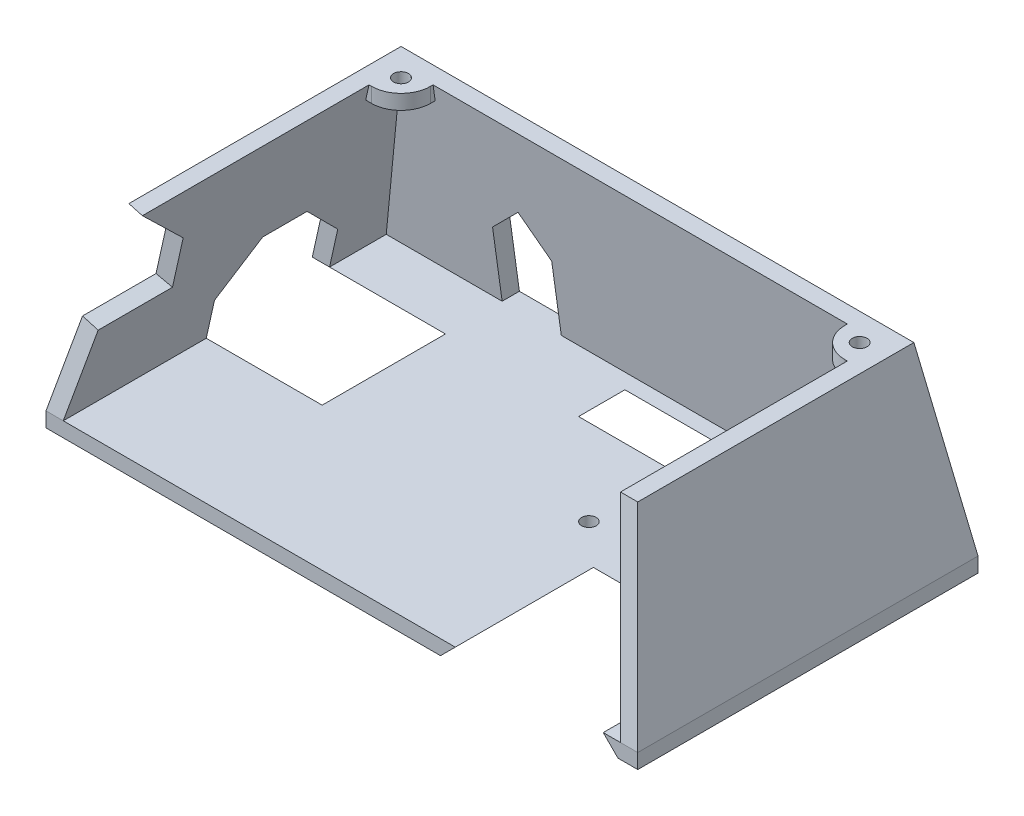
from build123d import *

# Parameters (mm, degrees)
SKETCH2_W           = 50
SKETCH2_H           = 9.4
BOSS_EXTRUDE1_DEPTH = 3
BOSS_EXTRUDE2_DEPTH = 3
CUT_EXTRUDE1_REACH  = 145.812
SKETCH6_R           = 1.5
SKETCH7_W           = 33
SKETCH7_H           = 25
CUT_EXTRUDE2_DEPTH  = 18.5
CHAMFER1_SIZE       = 3
CUT_EXTRUDE4_REACH  = 145.812
CHAMFER2_SIZE       = 3
CHAMFER3_SIZE       = 3
CUT_EXTRUDE5_REACH  = 145.812
SKETCH9_R           = 1.475
CUT_EXTRUDE6_REACH  = 146.305
CHAMFER4_SIZE       = 8


with BuildPart() as part:
    # Sketch2 → Boss-Extrude1 (new body)
    with BuildSketch(Plane(origin=(0, 0, 0), x_dir=(1, 0, 0), z_dir=(0, 1, 0))):
        Polygon((113, 0), (120, 0), (120, 69), (0, 69), (0, 0), (83, 0), (83, 28), (113, 28), align=None)
        with Locations((80, 57.7)):
            Rectangle(SKETCH2_W, SKETCH2_H, mode=Mode.SUBTRACT)
    extrude(amount=BOSS_EXTRUDE1_DEPTH)

    # Sketch4 → Loft1 section 0
    with BuildSketch(Plane(origin=(0, 39, 0), x_dir=(1, 0, 0), z_dir=(0, 1, 0))):
        with BuildLine():
            Line((11.5, 8), (8, 8))
            Line((8, 8), (8, 64))
            Line((8, 64), (112, 64))
            Line((112, 64), (112, 8))
            Line((112, 8), (108.5, 8))
            Line((108.5, 8), (108.5, 60.5))
            Line((108.5, 60.5), (11.5, 60.5))
            Line((11.5, 60.5), (11.5, 8))
        make_face()
    # Sketch3 → Loft1 section 1
    with BuildSketch(Plane(origin=(0, 3, 0), x_dir=(1, 0, 0), z_dir=(0, 1, 0))):
        with BuildLine():
            Line((3.5, 0), (3.5, 65.5))
            Line((3.5, 65.5), (116.5, 65.5))
            Line((116.5, 65.5), (116.5, 0))
            Line((116.5, 0), (120, 0))
            Line((120, 0), (120, 69))
            Line((120, 69), (0, 69))
            Line((0, 69), (0, 0))
            Line((0, 0), (3.5, 0))
        make_face()
    loft()

    # Sketch5 → Boss-Extrude2 (add)
    with BuildSketch(Plane(origin=(0, 39, 0), x_dir=(1, 0, 0), z_dir=(0, 1, 0))):
        with BuildLine():
            Line((8, 64), (18, 64))
            Line((18, 64), (18, 60))
            ThreePointArc((18, 60), (16.242640687, 55.757359313), (12, 54))
            Line((12, 54), (8, 54))
            Line((8, 54), (8, 64))
        make_face()
        with BuildLine():
            Line((112, 64), (102, 64))
            Line((102, 64), (102, 60))
            ThreePointArc((102, 60), (103.757359313, 55.757359313), (108, 54))
            Line((108, 54), (112, 54))
            Line((112, 54), (112, 64))
        make_face()
    extrude(amount=-BOSS_EXTRUDE2_DEPTH)

    # Sketch6 → Cut-Extrude1 (cut, up to next)
    with BuildSketch(Plane(origin=(0, 39, 0), x_dir=(1, 0, 0), z_dir=(0, 1, 0)), mode=Mode.PRIVATE) as cut_extrude1_sk1:
        with Locations(Location((13.5, 58.5, 0), (0, 0, 270))):
            Circle(SKETCH6_R)
    cut_extrude1_tool1 = extrude(cut_extrude1_sk1.sketch, amount=-CUT_EXTRUDE1_REACH, mode=Mode.PRIVATE) & part.part
    # Sketch6 → Cut-Extrude1 (cut, up to next)
    with BuildSketch(Plane(origin=(0, 39, 0), x_dir=(1, 0, 0), z_dir=(0, 1, 0)), mode=Mode.PRIVATE) as cut_extrude1_sk2:
        with Locations(Location((106.5, 58.5, 0), (0, 0, 270))):
            Circle(SKETCH6_R)
    cut_extrude1_tool2 = extrude(cut_extrude1_sk2.sketch, amount=-CUT_EXTRUDE1_REACH, mode=Mode.PRIVATE) & part.part
    add(cut_extrude1_tool1.solids().sort_by_distance((13.5, 39, -58.5))[0], mode=Mode.SUBTRACT)
    add(cut_extrude1_tool2.solids().sort_by_distance((106.5, 39, -58.5))[0], mode=Mode.SUBTRACT)

    # Sketch7 → Cut-Extrude2 (cut)
    with BuildSketch(Plane.XZ):
        with Locations((10.5, -41.5)):
            Rectangle(SKETCH7_W, SKETCH7_H)
    extrude(amount=-CUT_EXTRUDE2_DEPTH, mode=Mode.SUBTRACT)

    # Chamfer1
    chamfer1_edges = [part.edges().sort_by_distance(p)[0] for p in [
        (55, 0, -57.7),
        (80, 0, -62.4),
        (105, 0, -57.7),
        (80, 0, -53),
    ]]
    chamfer(chamfer1_edges, length=CHAMFER1_SIZE - 0.0001)  # a hair under: the kernel refuses the full size

    # Cut-Extrude4: up to this plane
    cut_extrude4_end = Plane(origin=(0, 8.981831945, -64.669190008), z_dir=(0, -0.1375683712746883, 0.9904922731777515))
    # Sketch8 → Cut-Extrude4 (cut, up to the surface)
    with BuildSketch(Plane(origin=(0, 0, -69), x_dir=(-1, 0, 0), z_dir=(0, 0, -1)), mode=Mode.PRIVATE) as cut_extrude4_sk1:
        Polygon((-27, 3), (-39, 3), (-39, 17.01), (-33.01, 23), (-32.99, 23), (-27, 17.01), align=None)
    cut_extrude4_tool1 = split(extrude(cut_extrude4_sk1.sketch, amount=-CUT_EXTRUDE4_REACH, mode=Mode.PRIVATE), bisect_by=cut_extrude4_end, keep=Keep.BOTH, mode=Mode.PRIVATE)
    add(cut_extrude4_tool1.solids().sort_by_distance((33, 11.593178, -69))[0], mode=Mode.SUBTRACT)

    # Chamfer2
    chamfer2_edges = [part.edges().sort_by_distance(p)[0] for p in [
        (83, 0, -14),
        (113, 0, -14),
        (98, 0, -28),
    ]]
    chamfer(chamfer2_edges, length=CHAMFER2_SIZE - 0.0001)  # a hair under: the kernel refuses the full size

    # Chamfer3
    chamfer3_edges = [part.edges().sort_by_distance(p)[0] for p in [
        (13.5, 0, -54),
        (27, 0, -41.5),
        (13.5, 0, -29),
    ]]
    chamfer(chamfer3_edges, length=CHAMFER3_SIZE - 0.0001)  # a hair under: the kernel refuses the full size

    # Sketch9 → Cut-Extrude5 (cut, up to next)
    with BuildSketch(Plane.XZ, mode=Mode.PRIVATE) as cut_extrude5_sk1:
        with Locations(Location((89.5, -35.6, 0), (0, 0, 270))):
            Circle(SKETCH9_R)
    cut_extrude5_tool1 = extrude(cut_extrude5_sk1.sketch, amount=-CUT_EXTRUDE5_REACH, mode=Mode.PRIVATE) & part.part
    # Sketch9 → Cut-Extrude5 (cut, up to next)
    with BuildSketch(Plane.XZ, mode=Mode.PRIVATE) as cut_extrude5_sk2:
        with Locations(Location((74.5, -35.6, 0), (0, 0, 270))):
            Circle(SKETCH9_R)
    cut_extrude5_tool2 = extrude(cut_extrude5_sk2.sketch, amount=-CUT_EXTRUDE5_REACH, mode=Mode.PRIVATE) & part.part
    add(cut_extrude5_tool1.solids().sort_by_distance((89.5, 0, -35.6))[0], mode=Mode.SUBTRACT)
    add(cut_extrude5_tool2.solids().sort_by_distance((74.5, 0, -35.6))[0], mode=Mode.SUBTRACT)

    # Sketch10 → Cut-Extrude6 (cut, up to next)
    with BuildSketch(Plane(origin=(-0.635294118, 0.141176471, 0), x_dir=(0, 0, 1), z_dir=(-0.9761870601839528, 0.21693045781865627, 0)), mode=Mode.PRIVATE) as cut_extrude6_sk1:
        Polygon((-0.780111958, 20), (-18.610201871, 20), (-18.610201871, 30), (-7.717228125, 40.892973746), align=None)
    cut_extrude6_tool1 = extrude(cut_extrude6_sk1.sketch, amount=-CUT_EXTRUDE6_REACH, mode=Mode.PRIVATE) & part.part
    add(cut_extrude6_tool1.solids().sort_by_distance((5.377692, 27.199615, -10.380545))[0], mode=Mode.SUBTRACT)

    # Chamfer4
    chamfer4_edges = [part.edges().sort_by_distance(p)[0] for p in [
        (5.194444444, 18.5, -29),
        (5.194444444, 18.5, -54),
    ]]
    chamfer(chamfer4_edges, length=CHAMFER4_SIZE)


solid = part.part
